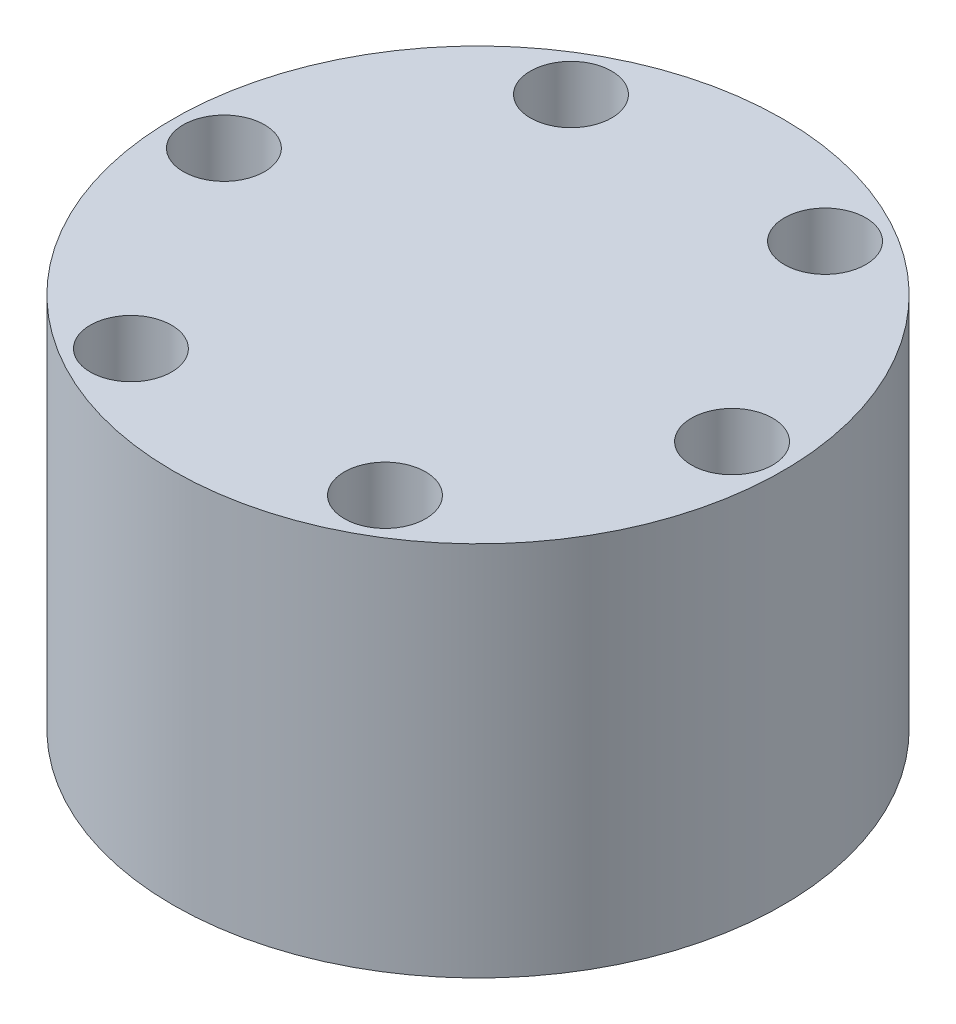
from build123d import *

# Parameters (mm, degrees)
SKETCH1_R           = 15
SKETCH1_R_2         = 1.5
BOSS_EXTRUDE1_DEPTH = 4
SKETCH2_R           = 15
BOSS_EXTRUDE2_DEPTH = 14.5
SKETCH5_R           = 2
CUT_EXTRUDE3_DEPTH  = 6.5
SKETCH6_R           = 7.5
CUT_EXTRUDE4_DEPTH  = 5


with BuildPart() as part:
    # Sketch1 → Boss-Extrude1 (new body)
    with BuildSketch(Plane(origin=(0, 0, 0), x_dir=(1, 0, 0), z_dir=(0, 1, 0))):
        Circle(SKETCH1_R)
        with Locations((0, 12.5)):
            Circle(SKETCH1_R_2, mode=Mode.SUBTRACT)
        with Locations((10.825317547, 6.25)):
            Circle(SKETCH1_R_2, mode=Mode.SUBTRACT)
        with Locations((10.825317547, -6.25)):
            Circle(SKETCH1_R_2, mode=Mode.SUBTRACT)
        with Locations((0, -12.5)):
            Circle(SKETCH1_R_2, mode=Mode.SUBTRACT)
        with Locations((-10.825317547, -6.25)):
            Circle(SKETCH1_R_2, mode=Mode.SUBTRACT)
        with Locations((-10.825317547, 6.25)):
            Circle(SKETCH1_R_2, mode=Mode.SUBTRACT)
    extrude(amount=BOSS_EXTRUDE1_DEPTH)

    # Sketch2 → Boss-Extrude2 (add)
    with BuildSketch(Plane(origin=(0, 4, 0), x_dir=(1, 0, 0), z_dir=(0, 1, 0))):
        Circle(SKETCH2_R)
    extrude(amount=BOSS_EXTRUDE2_DEPTH)

    # Sketch5 → Cut-Extrude3 (cut)
    with BuildSketch(Plane(origin=(0, 18.5, 0), x_dir=(1, 0, 0), z_dir=(0, 1, 0))):
        with Locations((-12.5, 0)):
            Circle(SKETCH5_R)
        with Locations((-6.25, 10.825317547)):
            Circle(SKETCH5_R)
        with Locations((6.25, 10.825317547)):
            Circle(SKETCH5_R)
        with Locations((12.5, 0)):
            Circle(SKETCH5_R)
        with Locations((6.25, -10.825317547)):
            Circle(SKETCH5_R)
        with Locations((-6.25, -10.825317547)):
            Circle(SKETCH5_R)
    extrude(amount=-CUT_EXTRUDE3_DEPTH, mode=Mode.SUBTRACT)

    # Sketch6 → Cut-Extrude4 (cut)
    with BuildSketch(Plane.XZ):
        Circle(SKETCH6_R)
    extrude(amount=-CUT_EXTRUDE4_DEPTH, mode=Mode.SUBTRACT)


solid = part.part
